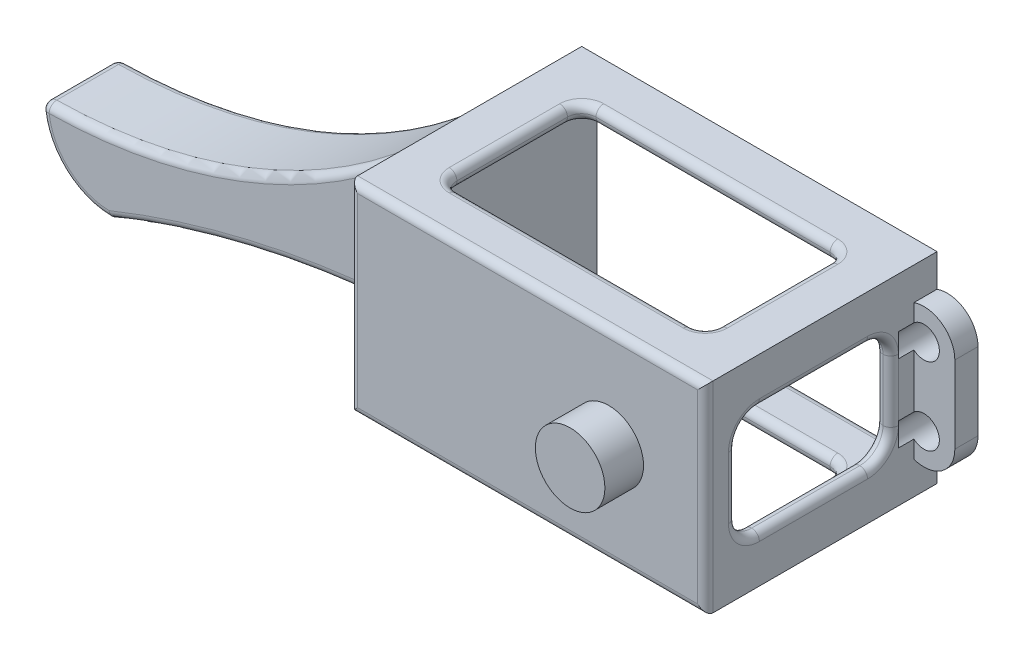
from build123d import *

# Parameters (mm, degrees)
SKETCH1_W               = 46
SKETCH1_H               = 26
BOSS_EXTRUDE3_DEPTH     = 30
SHELL1_T                = -2
CUT_EXTRUDE2_START      = 25
SKETCH4_R               = 2
CUT_EXTRUDE2_DEPTH      = 17
BOSS_EXTRUDE4_START     = -3
BOSS_EXTRUDE4_DEPTH     = 3
BOSS_EXTRUDE16_DEPTH    = 5
BOSS_EXTRUDE18_START    = -15
BOSS_EXTRUDE18_DEPTH    = 10
CUT_EXTRUDE5_DEPTH      = 91.603532065
CUT_EXTRUDE5_DEPTH_BACK = 91.603532065
FILLET50_R              = 1
CUT_EXTRUDE6_DEPTH      = 10
FILLET51_R              = 1
SKETCH18_R              = 161.753186417
CUT_EXTRUDE7_DEPTH      = 89.223411772


with BuildPart() as part:
    # Sketch1 → Boss-Extrude3 (new body)
    with BuildSketch(Plane.XY):
        Rectangle(SKETCH1_W, SKETCH1_H)
    extrude(amount=BOSS_EXTRUDE3_DEPTH)

    # Shell1
    shell1_openings = [part.faces().sort_by_distance(p)[0] for p in [
        (0, 0, 30),
    ]]
    offset(amount=SHELL1_T, openings=shell1_openings, kind=Kind.INTERSECTION)

    # Sketch4 → Cut-Extrude2 (cut)
    with BuildSketch(Plane.XY.offset(CUT_EXTRUDE2_START)):
        with Locations((24.3, 5)):
            Circle(SKETCH4_R)
        with Locations((24.3, -5)):
            Circle(SKETCH4_R)
        with Locations((-24.3, 5)):
            Circle(SKETCH4_R)
        with Locations((-24.3, -5)):
            Circle(SKETCH4_R)
    extrude(amount=CUT_EXTRUDE2_DEPTH, mode=Mode.SUBTRACT)

    # Sketch2 → Boss-Extrude4 (add)
    with BuildSketch(Plane.XY.offset(30).offset(BOSS_EXTRUDE4_START)):
        with BuildLine():
            ThreePointArc((-23, 8.782856064), (-26.623790008, 8.255764119), (-28.3, 5))
            Line((-28.3, 5), (-28.3, -5))
            ThreePointArc((-28.3, -5), (-26.623790008, -8.255764119), (-23, -8.782856064))
            Line((-23, -8.782856064), (-23, -6.519868415))
            ThreePointArc((-23, -6.519868415), (-26.3, -5), (-23, -3.480131585))
            Line((-23, -3.480131585), (-23, 3.480131585))
            ThreePointArc((-23, 3.480131585), (-26.3, 5), (-23, 6.519868415))
            Line((-23, 6.519868415), (-23, 8.782856064))
        make_face()
        with BuildLine():
            ThreePointArc((28.3, 5), (26.623790008, 8.255764119), (23, 8.782856064))
            Line((23, 8.782856064), (23, 6.519868415))
            ThreePointArc((23, 6.519868415), (26.3, 5), (23, 3.480131585))
            Line((23, 3.480131585), (23, -3.480131585))
            ThreePointArc((23, -3.480131585), (26.3, -5), (23, -6.519868415))
            Line((23, -6.519868415), (23, -8.782856064))
            ThreePointArc((23, -8.782856064), (26.623790008, -8.255764119), (28.3, -5))
            Line((28.3, -5), (28.3, 5))
        make_face()
    extrude(amount=BOSS_EXTRUDE4_DEPTH)

    # Sketch9 → Boss-Extrude16 (add)
    with BuildSketch(Plane.XY):
        with BuildLine():
            ThreePointArc((15, 0), (13.681980515, 3.181980515), (10.5, 4.5))
            Line((10.5, 4.5), (10.5, -4.5))
            ThreePointArc((10.5, -4.5), (13.681980515, -3.181980515), (15, 0))
        make_face()
        with BuildLine():
            Line((10.5, -4.5), (10.5, 4.5))
            ThreePointArc((10.5, 4.5), (6, 0), (10.5, -4.5))
        make_face()
    extrude(amount=-BOSS_EXTRUDE16_DEPTH)

    # Sketch14 → Boss-Extrude18 (add)
    with BuildSketch(Plane(origin=(0, 0, 0), x_dir=(-1, 0, 0), z_dir=(0, 0, -1)).offset(BOSS_EXTRUDE18_START)):
        with BuildLine():
            Line((23, 13), (23, -13))
            ThreePointArc((23, -13), (46.436083291, -15.271129848), (69, -22))
            ThreePointArc((69, -22), (75.363961031, -19.363961031), (78, -13))
            ThreePointArc((78, -13), (47.582077651, -6.172528045), (23, 13))
        make_face()
        with BuildLine():
            add(Edge.make_bspline(
                [(59.906165351, -13.759241877), (59.781268702, -13.717320791), (59.659348974, -13.685795892), (59.543496906, -13.667043022)],
                knots=[0.928317086, 0.928317086, 0.928317086, 0.928317086, 1, 1, 1, 1], degree=3))
            ThreePointArc((59.906165351, -13.759241877), (59.724772985, -13.713371159), (59.543496906, -13.667043022))
        make_face(mode=Mode.SUBTRACT)
    extrude(amount=-BOSS_EXTRUDE18_DEPTH)

    # Sketch6 → Cut-Extrude5 (cut, two sides: drawn at the far end of the back side and taken through both)
    with BuildSketch(Plane(origin=(0, 13, 0), x_dir=(1, 0, 0), z_dir=(0, 1, 0)).offset(-CUT_EXTRUDE5_DEPTH_BACK)):
        with BuildLine():
            Line((15.151778421, -6), (-15.151778421, -6))
            ThreePointArc((-15.151778421, -6), (-16.458668433, -6.541331567), (-17, -7.848221579))
            Line((-17, -7.848221579), (-17, -22.151778421))
            ThreePointArc((-17, -22.151778421), (-16.458668433, -23.458668433), (-15.151778421, -24))
            Line((-15.151778421, -24), (15.151778421, -24))
            ThreePointArc((15.151778421, -24), (16.458668433, -23.458668433), (17, -22.151778421))
            Line((17, -22.151778421), (17, -7.848221579))
            ThreePointArc((17, -7.848221579), (16.458668433, -6.541331567), (15.151778421, -6))
        make_face()
    extrude(amount=CUT_EXTRUDE5_DEPTH + CUT_EXTRUDE5_DEPTH_BACK, mode=Mode.SUBTRACT)

    # Fillet50
    fillet50_edges = [part.edges().sort_by_distance(p)[0] for p in [
        (16.458668433, 13, 6.541331567),
        (17, 13, 15),
        (16.458668433, 13, 23.458668433),
        (0, 13, 24),
        (-16.458668433, 13, 23.458668433),
        (-17, 13, 15),
        (-16.458668433, 13, 6.541331567),
        (-16.458668433, 11, 6.541331567),
        (-17, 11, 15),
        (-16.458668433, 11, 23.458668433),
        (0, 11, 24),
        (16.458668433, 11, 23.458668433),
        (17, 11, 15),
        (16.458668433, 11, 6.541331567),
        (16.458668433, -13, 6.541331567),
        (17, -13, 15),
        (16.458668433, -13, 23.458668433),
        (0, -13, 24),
        (-16.458668433, -13, 23.458668433),
        (-17, -13, 15),
        (-16.458668433, -13, 6.541331567),
        (16.458668433, -11, 6.541331567),
        (17, -11, 15),
        (16.458668433, -11, 23.458668433),
        (0, -11, 24),
        (-16.458668433, -11, 23.458668433),
        (-17, -11, 15),
        (-16.458668433, -11, 6.541331567),
        (-23, 0, 0),
        (0, -13, 0),
        (23, 0, 0),
        (0, 13, 0),
        (0, 13, 6),
        (0, 11, 6),
        (0, -13, 6),
        (0, -11, 6),
        (-75.363961031, -19.363961031, 15),
        (-75.363961031, -19.363961031, 25),
        (-46.436083291, -15.271129848, 15),
        (-46.436083291, -15.271129848, 25),
        (-78, -13, 20),
        (-47.582077651, -6.172528045, 15),
        (-47.582077651, -6.172528045, 25),
        (0, -11, 30),
        (0, 11, 30),
        (21, 0, 30),
    ]]
    fillet(fillet50_edges, radius=FILLET50_R - 0.0001)  # a hair under: the kernel refuses the full size

    # Sketch17 → Cut-Extrude6 (cut)
    with BuildSketch(Plane(origin=(23, 0, 0), x_dir=(0, 0, -1), z_dir=(1, 0, 0))):
        with BuildLine():
            Line((-24, 4), (-24, -4))
            ThreePointArc((-24, -4), (-23.121320344, -6.121320344), (-21, -7))
            Line((-21, -7), (-10, -7))
            ThreePointArc((-10, -7), (-7.878679656, -6.121320344), (-7, -4))
            Line((-7, -4), (-7, 4))
            ThreePointArc((-7, 4), (-7.878679656, 6.121320344), (-10, 7))
            Line((-10, 7), (-21, 7))
            ThreePointArc((-21, 7), (-23.121320344, 6.121320344), (-24, 4))
        make_face()
        with BuildLine():
            Line((-21, 4), (-21, -4))
            ThreePointArc((-21, -4), (-20.121320344, -6.121320344), (-18, -7))
            Line((-18, -7), (-7, -7))
            ThreePointArc((-7, -7), (-4.878679656, -6.121320344), (-4, -4))
            Line((-4, -4), (-4, 4))
            ThreePointArc((-4, 4), (-4.878679656, 6.121320344), (-7, 7))
            Line((-7, 7), (-18, 7))
            ThreePointArc((-18, 7), (-20.121320344, 6.121320344), (-21, 4))
        make_face()
    extrude(amount=-CUT_EXTRUDE6_DEPTH, mode=Mode.SUBTRACT)

    # Fillet51
    fillet51_edges = [part.edges().sort_by_distance(p)[0] for p in [
        (21, -6.121320344, 4.878679656),
        (21, -7, 14),
        (21, -6.121320344, 23.121320344),
        (21, 0, 24),
        (21, 6.121320344, 23.121320344),
        (21, 7, 14),
        (21, 6.121320344, 4.878679656),
        (23, 6.121320344, 4.878679656),
        (23, 7, 14),
        (23, 6.121320344, 23.121320344),
        (23, 0, 24),
        (23, -6.121320344, 23.121320344),
        (23, -7, 14),
        (23, -6.121320344, 4.878679656),
        (21, 0, 4),
        (23, 0, 4),
    ]]
    fillet(fillet51_edges, radius=FILLET51_R - 0.0001)  # a hair under: the kernel refuses the full size

    # Mirror1: part across plane


with BuildPart() as part_1:
    add(part.part)
    add(part.part.mirror(Plane(origin=(0, 0, 30), x_dir=(1, 0, 0), z_dir=(0, 0, -1))))

    # Sketch18 → Cut-Extrude7 (cut, through all)
    with BuildSketch(Plane.XY.offset(30)):
        with Locations((1.411877665, 0)):
            Circle(SKETCH18_R)
    extrude(amount=-CUT_EXTRUDE7_DEPTH, mode=Mode.SUBTRACT)


solid = part_1.part
